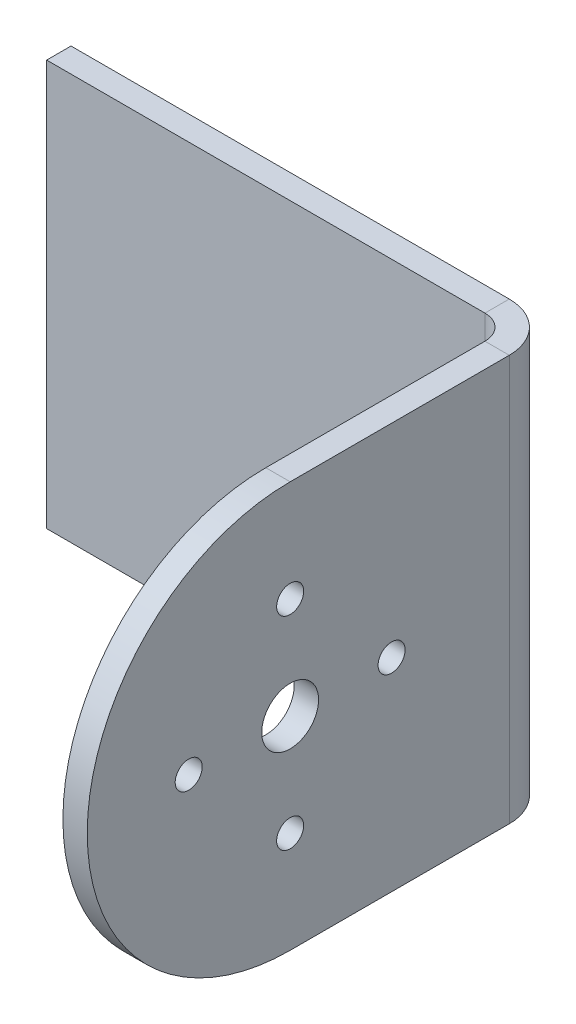
from build123d import *

# Parameters (mm, degrees)
SKETCH1_W                    = 60
SKETCH1_H                    = 50
BASE_FLANGE1_DEPTH           = 3
EDGE_FLANGE1_STRIP_W         = 18
EDGE_FLANGE1_STRIP_H         = 3
EDGE_FLANGE1_STRIP_CUT_DEPTH = 50
EDGE_FLANGE1_DEPTH           = 50
CUT_EXTRUDE1_DEPTH           = 10
SKETCH10_R                   = 3.5
SKETCH10_R_2                 = 1.665
CUT_EXTRUDE2_DEPTH           = 10


# Sheet-metal steps are written as plain solids
with BuildPart() as part:
    # Sketch1 → Base-Flange1 (new body)
    with BuildSketch(Plane.XY):
        Rectangle(SKETCH1_W, SKETCH1_H)
    extrude(amount=-BASE_FLANGE1_DEPTH)

    # Edge-Flange1 strip (across the edge) → Edge-Flange1 strip cut (cut)
    with BuildSketch(Plane(origin=(30, -25, 0), x_dir=(-1, 0, 0), z_dir=(0, 1, 0))):
        with Locations((-3, -1.5)):
            Rectangle(EDGE_FLANGE1_STRIP_W, EDGE_FLANGE1_STRIP_H)
    extrude(amount=EDGE_FLANGE1_STRIP_CUT_DEPTH, mode=Mode.SUBTRACT)

    # Edge-Flange1 section (across the edge) → Edge-Flange1 (add)
    with BuildSketch(Plane(origin=(30, -25, 0), x_dir=(-1, 0, 0), z_dir=(0, 1, 0))):
        with BuildLine():
            Line((0, 3), (0, 57))
            Line((0, 57), (3, 57))
            Line((3, 57), (3, 3))
            ThreePointArc((3, 3), (3.878679656, 0.878679656), (6, 0))
            Line((6, 0), (6, -3))
            ThreePointArc((6, -3), (1.757359313, -1.242640687), (0, 3))
        make_face()
    extrude(amount=EDGE_FLANGE1_DEPTH)

    # Sketch9 → Cut-Extrude1 (cut)
    with BuildSketch(Plane(origin=(30, 0, 0), x_dir=(0, 0, -1), z_dir=(1, 0, 0))):
        with BuildLine():
            Line((-30, 25), (-57, 25))
            Line((-57, 25), (-57, -25))
            Line((-57, -25), (-30, -25))
            ThreePointArc((-30, -25), (-55, 0), (-30, 25))
        make_face()
    extrude(amount=-CUT_EXTRUDE1_DEPTH, mode=Mode.SUBTRACT)

    # Sketch10 → Cut-Extrude2 (cut)
    with BuildSketch(Plane(origin=(30, 0, 0), x_dir=(0, 0, -1), z_dir=(1, 0, 0))):
        with Locations((-30, 0)):
            Circle(SKETCH10_R)
        with Locations((-30, 12.5)):
            Circle(SKETCH10_R_2)
        with Locations((-42.5, 0)):
            Circle(SKETCH10_R_2)
        with Locations(Location((-30, -12.5, 0), (0, 0, 180))):
            Circle(SKETCH10_R_2)
        with Locations(Location((-17.5, 0, 0), (0, 0, 180))):
            Circle(SKETCH10_R_2)
    extrude(amount=-CUT_EXTRUDE2_DEPTH, mode=Mode.SUBTRACT)


solid = part.part
